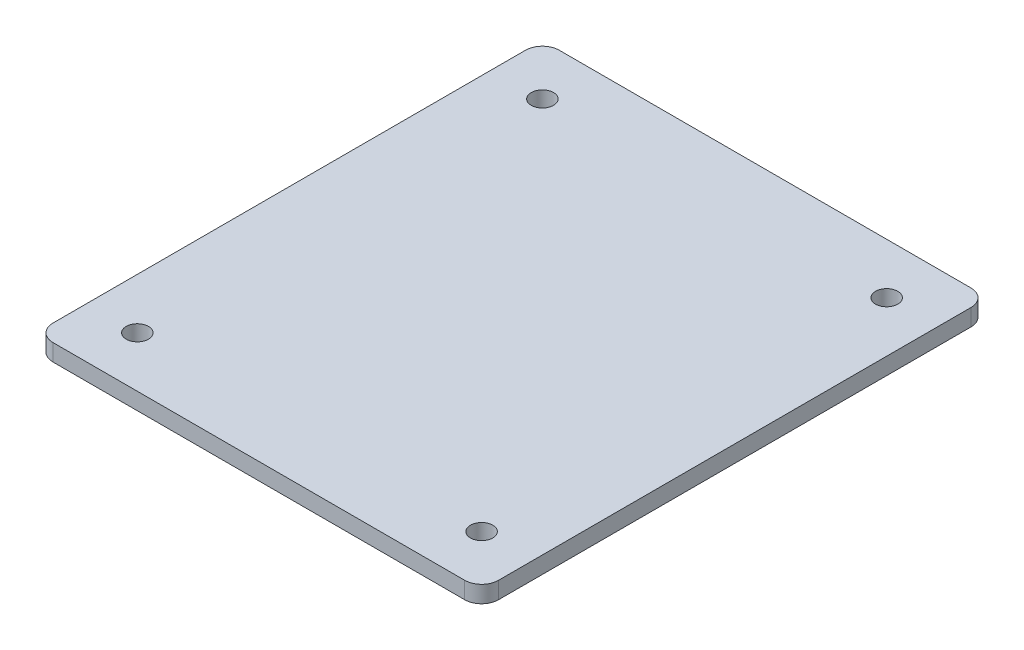
from build123d import *

# Parameters (mm, degrees)
SKETCH1_W                = 132
SKETCH1_H                = 150
BOSS_EXTRUDE1_DEPTH      = 5
M6_CLEARANCE_HOLE1_D     = 6.6
M6_CLEARANCE_HOLE1_DEPTH = 10
M6_CLEARANCE_HOLE1_TIP   = 1.982840043
FILLET1_R                = 5


with BuildPart() as part:
    # Sketch1 → Boss-Extrude1 (new body)
    with BuildSketch(Plane(origin=(0, 0, 0), x_dir=(1, 0, 0), z_dir=(0, 1, 0))):
        with Locations((66, 75)):
            Rectangle(SKETCH1_W, SKETCH1_H)
    extrude(amount=BOSS_EXTRUDE1_DEPTH)

    # M6 Clearance Hole1
    with Locations(Plane(origin=(0, 0, 0), x_dir=(-1, 0, 0), z_dir=(0, -1, 0))):
        with Locations((-15, 15), (-117, 15), (-117, 135), (-15, 135)):
            Hole(M6_CLEARANCE_HOLE1_D / 2, depth=M6_CLEARANCE_HOLE1_DEPTH)
            with Locations((0, 0, -(M6_CLEARANCE_HOLE1_DEPTH + M6_CLEARANCE_HOLE1_TIP / 2))):  # 118° drill point
                Cone(0, M6_CLEARANCE_HOLE1_D / 2, M6_CLEARANCE_HOLE1_TIP, mode=Mode.SUBTRACT)

    # Fillet1
    fillet1_edges = [part.edges().sort_by_distance(p)[0] for p in [
        (132, 2.5, -150),
        (132, 2.5, 0),
        (0, 2.5, 0),
        (0, 2.5, -150),
    ]]
    fillet(fillet1_edges, radius=FILLET1_R)


solid = part.part
